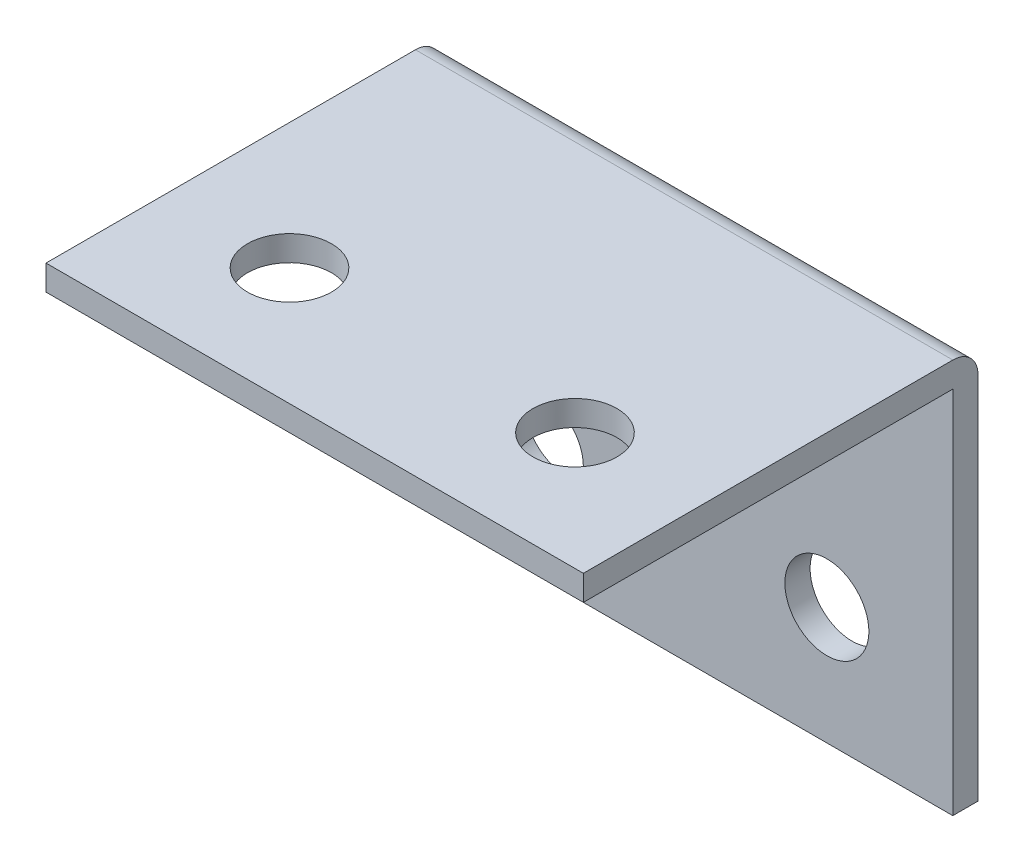
from build123d import *

# Parameters (mm, degrees)
SKETCH_1_W          = 32
SKETCH_1_H          = 23.5
EXTRUDE_2_DEPTH     = 23.5
SHELL_1_T           = -1.5
FILLET_2_R          = 1.5
SKETCH_3_R          = 2.5
CUT_EXTRUDE_2_DEPTH = 23.5
SKETCH_5_R          = 2.5
CUT_EXTRUDE_3_DEPTH = 23.5


with BuildPart() as part:
    # 草图1 → 凸台-拉伸2 (new body)
    with BuildSketch(Plane.XY):
        with Locations((16, 11.75)):
            Rectangle(SKETCH_1_W, SKETCH_1_H)
    extrude(amount=EXTRUDE_2_DEPTH)

    # 抽壳1
    shell_1_openings = [part.faces().sort_by_distance(p)[0] for p in [
        (32, 11.75, 11.75),
        (16, 11.75, 23.5),
        (0, 11.75, 11.75),
        (16, 0, 11.75),
    ]]
    offset(amount=SHELL_1_T, openings=shell_1_openings, kind=Kind.INTERSECTION)

    # 圆角2
    fillet_2_edges = [part.edges().sort_by_distance(p)[0] for p in [
        (16, 23.5, 0),
    ]]
    fillet(fillet_2_edges, radius=FILLET_2_R)

    # 草图3 → 切除-拉伸2 (cut)
    with BuildSketch(Plane.XY.offset(1.5)):
        with Locations((7.5, 7)):
            Circle(SKETCH_3_R)
        with Locations((24.5, 7)):
            Circle(SKETCH_3_R)
    extrude(amount=-CUT_EXTRUDE_2_DEPTH, mode=Mode.SUBTRACT)

    # 草图5 → 切除-拉伸3 (cut)
    with BuildSketch(Plane.XZ.offset(-22)):
        with Locations((7.5, 16.5)):
            Circle(SKETCH_5_R)
        with Locations((24.5, 16.5)):
            Circle(SKETCH_5_R)
    extrude(amount=-CUT_EXTRUDE_3_DEPTH, mode=Mode.SUBTRACT)


solid = part.part
